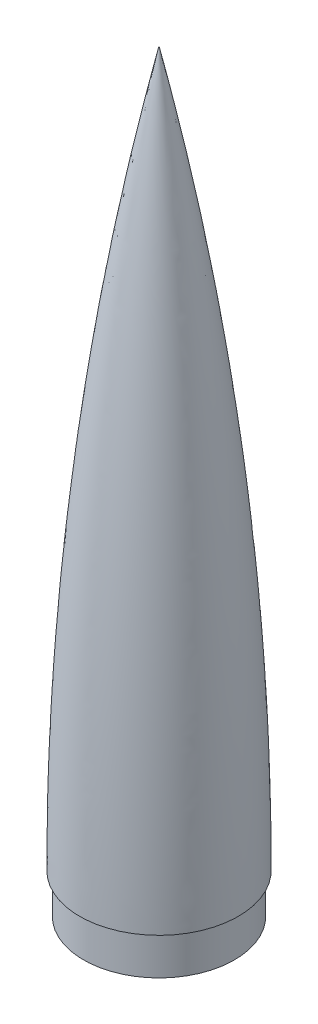
from build123d import *


with BuildPart() as part:
    # Sketch1 → Revolve1 (revolve)
    with BuildSketch(Plane.XY):
        with BuildLine():
            Line((-25.4, 0), (-24.1554, 0))
            Line((-24.1554, 0), (-24.1554, -12.7))
            Line((-24.1554, -12.7), (0, -12.7))
            Line((0, -12.7), (0, 228.6))
            ThreePointArc((0, 228.6), (-19.030521289, 115.003391254), (-25.4, 0))
        make_face()
    revolve(axis=Axis((0, -12.7, 0), (0, 1, 0)))


solid = part.part
